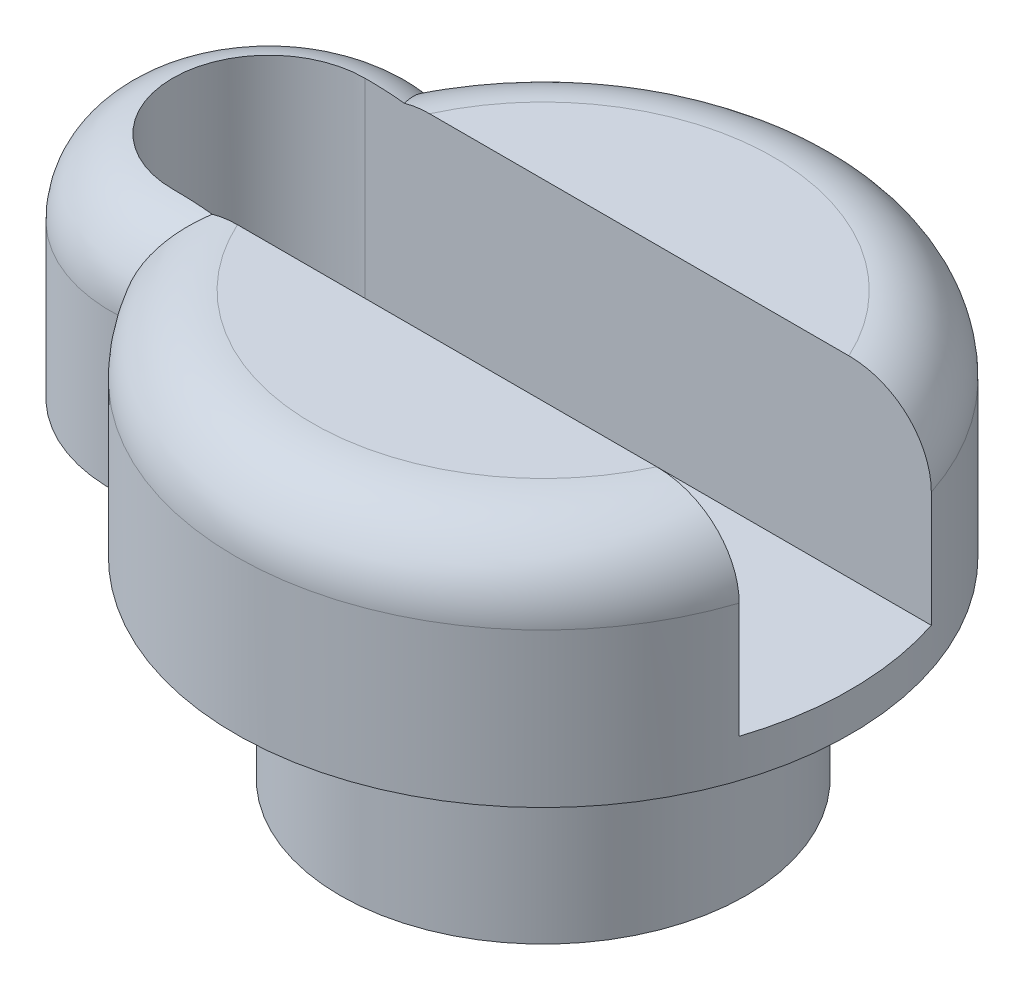
from build123d import *

# Parameters (mm, degrees)
SKETCH1_R           = 3.3528
SKETCH1_R_2         = 2.4638
BOSS_EXTRUDE1_DEPTH = 3.175
SKETCH2_R           = 5.08
BOSS_EXTRUDE2_DEPTH = 3.81
BOSS_EXTRUDE3_START = -3.81
SKETCH3_R           = 5.08
SKETCH3_R_2         = 2.6035
SKETCH3_R_3         = 1.5875
BOSS_EXTRUDE3_DEPTH = 3.81
CUT_EXTRUDE1_START  = -3.175
CUT_EXTRUDE1_DEPTH  = 3.175
FILLET1_R           = 1.27


with BuildPart() as part:
    # Sketch1 → Boss-Extrude1 (new body)
    with BuildSketch(Plane(origin=(0, 0, 0), x_dir=(1, 0, 0), z_dir=(0, 1, 0))):
        with Locations(Location((0, 0, 0), (0, 0, 270))):
            Circle(SKETCH1_R)
        with Locations(Location((0, 0, 0), (0, 0, 270))):
            Circle(SKETCH1_R_2, mode=Mode.SUBTRACT)
    extrude(amount=BOSS_EXTRUDE1_DEPTH)

    # Sketch2 → Boss-Extrude2 (add)
    with BuildSketch(Plane(origin=(0, 3.175, 0), x_dir=(1, 0, 0), z_dir=(0, 1, 0))):
        with Locations(Location((0, 0, 0), (0, 0, 90))):
            Circle(SKETCH2_R)
    extrude(amount=BOSS_EXTRUDE2_DEPTH)

    # Sketch3 → Boss-Extrude3 (add)
    # profile 1 of 3: a face of its own
    with BuildSketch(Plane(origin=(0, 6.985, 0), x_dir=(1, 0, 0), z_dir=(0, 1, 0)).offset(BOSS_EXTRUDE3_START)):
        Circle(SKETCH3_R)
    # profile 2 of 3: a face of its own
    with BuildSketch(Plane(origin=(0, 6.985, 0), x_dir=(1, 0, 0), z_dir=(0, 1, 0)).offset(BOSS_EXTRUDE3_START)):
        with Locations((-4.533681302, 0)):
            Circle(SKETCH3_R_2)
        with Locations((-4.533681302, 0)):
            Circle(SKETCH3_R_3, mode=Mode.SUBTRACT)
    # profile 3 of 3: a face of its own
    with BuildSketch(Plane(origin=(0, 6.985, 0), x_dir=(1, 0, 0), z_dir=(0, 1, 0)).offset(BOSS_EXTRUDE3_START)):
        Circle(SKETCH3_R)
    extrude(amount=BOSS_EXTRUDE3_DEPTH)

    # Sketch4 → Cut-Extrude1 (cut)
    with BuildSketch(Plane(origin=(0, 6.985, 0), x_dir=(1, 0, 0), z_dir=(0, 1, 0)).offset(CUT_EXTRUDE1_START)):
        with BuildLine():
            ThreePointArc((-4.834979234, -1.558645504), (-4.685019521, -1.580269912), (-4.533681302, -1.5875))
            Line((-4.533681302, -1.5875), (4.825582219, -1.5875))
            ThreePointArc((4.825582219, -1.5875), (5.015992308, -0.803878824), (5.08, 0))
            ThreePointArc((5.08, 0), (5.015992308, 0.803878824), (4.825582219, 1.5875))
            Line((4.825582219, 1.5875), (-4.533681302, 1.5875))
            ThreePointArc((-4.533681302, 1.5875), (-4.685019521, 1.580269912), (-4.834979234, 1.558645504))
            ThreePointArc((-4.834979234, 1.558645504), (-5.08, 0), (-4.834979234, -1.558645504))
        make_face()
    extrude(amount=CUT_EXTRUDE1_DEPTH, mode=Mode.SUBTRACT)

    # Fillet1
    # the kernel refuses this fillet: 1.27 mm, written as the material it takes off along each edge
    with BuildSketch(Plane(origin=(-4.533681302, 6.985, 0), x_dir=(0.9598113025197432, 0, -0.2806461536443247), z_dir=(0.2806461536443247, 0, 0.9598113025197432))) as fillet1_piece_1_section:
        with BuildLine():
            CenterArc((2.6035 - FILLET1_R, -FILLET1_R), FILLET1_R, 0, 90)
            Line((2.6035, -FILLET1_R), (2.6035, 0))
            Line((2.6035, 0), (2.6035 - FILLET1_R, 0))
        make_face()
    fillet1_piece_1 = revolve(axis=Axis((-4.533681302, 6.985, 0), (0, 1, 0)), revolution_arc=327.402454095, mode=Mode.PRIVATE)
    fillet1_piece_1 = split(fillet1_piece_1, bisect_by=Plane(origin=(-4.533681302, 6.985, 1.5875), z_dir=(0, 0, -1)), keep=Keep.TOP, mode=Mode.PRIVATE)
    fillet1_piece_1 = split(fillet1_piece_1, bisect_by=Plane(origin=(-4.533681302, 6.985, -1.5875), z_dir=(0, 0, 1)), keep=Keep.TOP, mode=Mode.PRIVATE)
    add(fillet1_piece_1, mode=Mode.SUBTRACT)
    with BuildSketch(Plane(origin=(-4.533681302, 6.985, 0), x_dir=(0.9598113025197432, 0, -0.2806461536443247), z_dir=(0.2806461536443247, 0, 0.9598113025197432))) as fillet1_piece_2_section:
        with BuildLine():
            CenterArc((2.6035 - FILLET1_R, -FILLET1_R), FILLET1_R, 0, 90)
            Line((2.6035, -FILLET1_R), (2.6035, 0))
            Line((2.6035, 0), (2.6035 - FILLET1_R, 0))
        make_face()
    fillet1_piece_2 = revolve(axis=Axis((-4.533681302, 6.985, 0), (0, 1, 0)), revolution_arc=327.402454095, mode=Mode.PRIVATE)
    fillet1_piece_2 = fillet1_piece_2 - Plane(origin=(0, 6.985, 0), x_dir=(0, 0, -1), z_dir=(0, -1, 0)) * Cylinder(5.08, 11, mode=Mode.PRIVATE)
    add(fillet1_piece_2, mode=Mode.SUBTRACT)
    with BuildSketch(Plane(origin=(0, 6.985, 0), x_dir=(-0.9960699199988063, 0, 0.08857039275949603), z_dir=(0.08857039275949603, 0, 0.9960699199988063))) as fillet1_piece_3_section:
        with BuildLine():
            CenterArc((5.08 - FILLET1_R, FILLET1_R), FILLET1_R, 270, 90)
            Line((5.08 - FILLET1_R, 0), (5.08, 0))
            Line((5.08, 0), (5.08, FILLET1_R))
        make_face()
    fillet1_piece_3 = revolve(axis=Axis((0, 6.985, 0), (0, -1, 0)), revolution_arc=202.711774456, mode=Mode.PRIVATE)
    fillet1_piece_3 = fillet1_piece_3 - Plane(origin=(-4.533681302, 6.985, 0), x_dir=(1, 0, 0), z_dir=(0, -1, 0)) * Cylinder(2.6035, 21, mode=Mode.PRIVATE)
    add(fillet1_piece_3, mode=Mode.SUBTRACT)
    with BuildSketch(Plane(origin=(0, 6.985, 0), x_dir=(0.9530300689504536, 0, -0.30287569674091297), z_dir=(-0.30287569674091297, 0, -0.9530300689504536))) as fillet1_piece_4_section:
        with BuildLine():
            CenterArc((5.08 - FILLET1_R, FILLET1_R), FILLET1_R, 270, 90)
            Line((5.08 - FILLET1_R, 0), (5.08, 0))
            Line((5.08, 0), (5.08, FILLET1_R))
        make_face()
    fillet1_piece_4 = revolve(axis=Axis((0, 6.985, 0), (0, -1, 0)), revolution_arc=202.711774456, mode=Mode.PRIVATE)
    fillet1_piece_4 = fillet1_piece_4 - Plane(origin=(-4.533681302, 6.985, 0), x_dir=(1, 0, 0), z_dir=(0, -1, 0)) * Cylinder(2.6035, 21, mode=Mode.PRIVATE)
    add(fillet1_piece_4, mode=Mode.SUBTRACT)
    with BuildSketch(Plane(origin=(0, 6.985, 0), x_dir=(-0.9960699199988063, 0, 0.08857039275949603), z_dir=(0.08857039275949603, 0, 0.9960699199988063))) as fillet1_piece_5a_section:
        with BuildLine():
            CenterArc((5.08 - FILLET1_R, FILLET1_R), FILLET1_R, 270, 90)
            Line((5.08 - FILLET1_R, 0), (5.08, 0))
            Line((5.08, 0), (5.08, FILLET1_R))
        make_face()
    fillet1_piece_5a = revolve(axis=Axis((0, 6.985, 0), (0, -1, 0)), revolution_arc=202.711774456, mode=Mode.PRIVATE)
    fillet1_piece_5a = split(fillet1_piece_5a, bisect_by=Plane(origin=(0, 6.985, -1.5875), z_dir=(0, 0, -1)), keep=Keep.TOP, mode=Mode.PRIVATE)
    fillet1_piece_5a = fillet1_piece_5a & Plane(origin=(-4.533681302, 6.985, 0), x_dir=(1, 0, 0), z_dir=(0, -1, 0)) * Cylinder(2.6035, 21, mode=Mode.PRIVATE)
    with BuildSketch(Plane(origin=(-4.533681302, 6.985, 0), x_dir=(0.9598113025197432, 0, -0.2806461536443247), z_dir=(0.2806461536443247, 0, 0.9598113025197432))) as fillet1_piece_5b_section:
        with BuildLine():
            CenterArc((2.6035 - FILLET1_R, -FILLET1_R), FILLET1_R, 0, 90)
            Line((2.6035, -FILLET1_R), (2.6035, 0))
            Line((2.6035, 0), (2.6035 - FILLET1_R, 0))
        make_face()
    fillet1_piece_5b = revolve(axis=Axis((-4.533681302, 6.985, 0), (0, 1, 0)), revolution_arc=327.402454095, mode=Mode.PRIVATE)
    fillet1_piece_5b = fillet1_piece_5b & Plane(origin=(0, 6.985, 0), x_dir=(0, 0, -1), z_dir=(0, -1, 0)) * Cylinder(5.08, 11, mode=Mode.PRIVATE)
    fillet1_piece_5b = split(fillet1_piece_5b, bisect_by=Plane(origin=(-4.533681302, 6.985, -1.5875), z_dir=(0, 0, -1)), keep=Keep.TOP, mode=Mode.PRIVATE)
    fillet1_piece_5 = fillet1_piece_5a & fillet1_piece_5b
    add(fillet1_piece_5, mode=Mode.SUBTRACT)
    with BuildSketch(Plane(origin=(0, 6.985, 0), x_dir=(0.9530300689504536, 0, -0.30287569674091297), z_dir=(-0.30287569674091297, 0, -0.9530300689504536))) as fillet1_piece_6a_section:
        with BuildLine():
            CenterArc((5.08 - FILLET1_R, FILLET1_R), FILLET1_R, 270, 90)
            Line((5.08 - FILLET1_R, 0), (5.08, 0))
            Line((5.08, 0), (5.08, FILLET1_R))
        make_face()
    fillet1_piece_6a = revolve(axis=Axis((0, 6.985, 0), (0, -1, 0)), revolution_arc=202.711774456, mode=Mode.PRIVATE)
    fillet1_piece_6a = split(fillet1_piece_6a, bisect_by=Plane(origin=(0, 6.985, 1.5875), z_dir=(0, 0, 1)), keep=Keep.TOP, mode=Mode.PRIVATE)
    fillet1_piece_6a = fillet1_piece_6a & Plane(origin=(-4.533681302, 6.985, 0), x_dir=(1, 0, 0), z_dir=(0, -1, 0)) * Cylinder(2.6035, 21, mode=Mode.PRIVATE)
    with BuildSketch(Plane(origin=(-4.533681302, 6.985, 0), x_dir=(0.9598113025197432, 0, -0.2806461536443247), z_dir=(0.2806461536443247, 0, 0.9598113025197432))) as fillet1_piece_6b_section:
        with BuildLine():
            CenterArc((2.6035 - FILLET1_R, -FILLET1_R), FILLET1_R, 0, 90)
            Line((2.6035, -FILLET1_R), (2.6035, 0))
            Line((2.6035, 0), (2.6035 - FILLET1_R, 0))
        make_face()
    fillet1_piece_6b = revolve(axis=Axis((-4.533681302, 6.985, 0), (0, 1, 0)), revolution_arc=327.402454095, mode=Mode.PRIVATE)
    fillet1_piece_6b = fillet1_piece_6b & Plane(origin=(0, 6.985, 0), x_dir=(0, 0, -1), z_dir=(0, -1, 0)) * Cylinder(5.08, 11, mode=Mode.PRIVATE)
    fillet1_piece_6b = split(fillet1_piece_6b, bisect_by=Plane(origin=(-4.533681302, 6.985, 1.5875), z_dir=(0, 0, 1)), keep=Keep.TOP, mode=Mode.PRIVATE)
    fillet1_piece_6 = fillet1_piece_6a & fillet1_piece_6b
    add(fillet1_piece_6, mode=Mode.SUBTRACT)


solid = part.part
